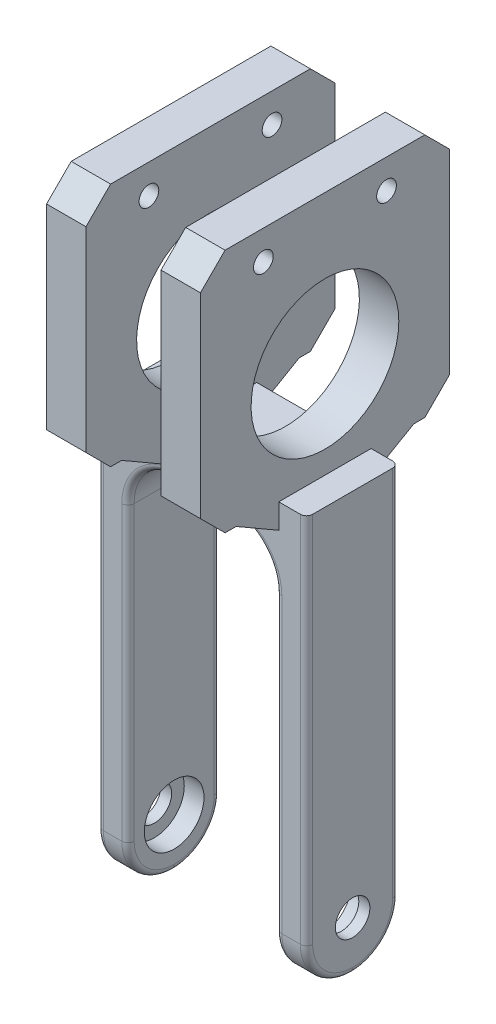
from build123d import *

# Parameters (mm, degrees)
SKETCH_1_W          = 34
SKETCH_1_H          = 15
EXTRUDE_1_DEPTH     = 68
SKETCH_3_W          = 24
SKETCH_3_H          = 63
CUT_EXTRUDE_1_DEPTH = 72.67984375
FILLET_1_R          = 8
FILLET_3_R          = 7.5
FILLET_2_R          = 1
SKETCH_4_R          = 2.8
CUT_EXTRUDE_2_DEPTH = 77.395353351
SKETCH_6_R          = 4.85
CUT_EXTRUDE_4_DEPTH = 3.2
SKETCH_7_W          = 40.44939287
SKETCH_7_H          = 39.770190269
SKETCH_7_R          = 12
SKETCH_7_R_2        = 1.6
EXTRUDE_2_DEPTH     = 12.5
SKETCH_8_W          = 12.191161996
SKETCH_8_H          = 39.770190269
CUT_EXTRUDE_5_DEPTH = 81.926839783
CHAMFER_1_SIZE      = 4
CHAMFER_1_SIZE_2    = 6.92820323
CHAMFER_2_SIZE      = 4


# Some blends are built 0.0001 mm under size
with BuildPart() as part:
    # 草图1 → 凸台-拉伸1 (new body)
    with BuildSketch(Plane(origin=(0, 0, 0), x_dir=(1, 0, 0), z_dir=(0, 1, 0))):
        Rectangle(SKETCH_1_W, SKETCH_1_H)
    extrude(amount=-EXTRUDE_1_DEPTH)

    # 草图3 → 切除-拉伸1 (cut, through all)
    with BuildSketch(Plane.XY.offset(7.5)):
        with Locations((0, -36.5)):
            Rectangle(SKETCH_3_W, SKETCH_3_H)
    extrude(amount=-CUT_EXTRUDE_1_DEPTH, mode=Mode.SUBTRACT)

    # 圆角1
    fillet_1_edges = [part.edges().sort_by_distance(p)[0] for p in [
        (-12, -5, 0),
        (12, -5, 0),
    ]]
    fillet(fillet_1_edges, radius=FILLET_1_R)

    # 圆角3
    fillet_3_edges = [part.edges().sort_by_distance(p)[0] for p in [
        (14.5, -68, -7.5),
        (14.5, -68, 7.5),
        (-14.5, -68, -7.5),
        (-14.5, -68, 7.5),
    ]]
    fillet(fillet_3_edges, radius=FILLET_3_R - 0.0001)  # a hair under: the kernel refuses the full size

    # 圆角2
    fillet_2_edges = [part.edges().sort_by_distance(p)[0] for p in [
        (0, -5, 7.5),
        (0, -5, -7.5),
        (-12, -36.75005, 7.5),
        (-12, -36.75005, -7.5),
        (9.656854249, -7.343145751, 7.5),
        (9.656854249, -7.343145751, -7.5),
        (-9.656854249, -7.343145751, 7.5),
        (-9.656854249, -7.343145751, -7.5),
        (-17, -30.25005, -7.5),
        (17, -30.25005, -7.5),
        (12, -36.75005, -7.5),
        (12, -36.75005, 7.5),
        (12, -65.803330148, 5.303330148),
        (12, -65.803330148, -5.303330148),
        (17, -30.25005, 7.5),
        (17, -65.803330148, 5.303330148),
        (17, -65.803330148, -5.303330148),
        (-17, -30.25005, 7.5),
        (-17, -65.803330148, 5.303330148),
        (-17, -65.803330148, -5.303330148),
        (-12, -65.803330148, 5.303330148),
        (-12, -65.803330148, -5.303330148),
    ]]
    fillet(fillet_2_edges, radius=FILLET_2_R)

    # 草图4 → 切除-拉伸2 (cut, through all)
    with BuildSketch(Plane(origin=(17, 0, 0), x_dir=(0, 0, -1), z_dir=(1, 0, 0))):
        with Locations((0, -60)):
            Circle(SKETCH_4_R)
    extrude(amount=-CUT_EXTRUDE_2_DEPTH, mode=Mode.SUBTRACT)

    # 草图6 → 切除-拉伸4 (cut)
    with BuildSketch(Plane(origin=(12, 0, 0), x_dir=(0, 0, -1), z_dir=(1, 0, 0))):
        with Locations((0, -60)):
            Circle(SKETCH_6_R)
    cut_extrude_4 = extrude(amount=CUT_EXTRUDE_4_DEPTH, mode=Mode.SUBTRACT)

    # 镜向1: 切除-拉伸4 across plane
    add(cut_extrude_4.mirror(Plane(origin=(0, 0, 0), x_dir=(0, 0, 1), z_dir=(1, 0, 0))), mode=Mode.SUBTRACT)

    # 草图7 → 凸台-拉伸2 (add, symmetric)
    with BuildSketch(Plane(origin=(0, 0, 0), x_dir=(0, 0, -1), z_dir=(1, 0, 0))):
        with Locations((0, 19.885095135)):
            Rectangle(SKETCH_7_W, SKETCH_7_H)
        with Locations((0, 15.650854712)):
            Circle(SKETCH_7_R, mode=Mode.SUBTRACT)
        with Locations((-10, 35)):
            Circle(SKETCH_7_R_2, mode=Mode.SUBTRACT)
        with Locations((10, 35)):
            Circle(SKETCH_7_R_2, mode=Mode.SUBTRACT)
    extrude(amount=EXTRUDE_2_DEPTH, both=True)

    # 草图8 → 切除-拉伸5 (cut, through all)
    with BuildSketch(Plane.XY.offset(20.224696435)):
        with Locations((0, 19.885095135)):
            Rectangle(SKETCH_8_W, SKETCH_8_H)
    extrude(amount=-CUT_EXTRUDE_5_DEPTH, mode=Mode.SUBTRACT)

    # 倒角1
    # the kernel refuses this chamfer: 6.92820323, 4 mm, written as the material it adds along each edge
    with BuildSketch(Plane(origin=(-12.5, 0, 7.5), x_dir=(0, -0.9983227437537926, -0.057893862402671484), z_dir=(1, 0, 0)), Plane(origin=(6.095580998, 0, 7.5), x_dir=(0, -0.9983227437537926, -0.057893862402671484), z_dir=(1, 0, 0)), Plane(origin=(12.5, 0, -7.5), x_dir=(0, -0.9983227437537926, 0.057893862402671484), z_dir=(-1, 0, 0)), Plane(origin=(-6.095580998, 0, -7.5), x_dir=(0, -0.9983227437537926, 0.057893862402671484), z_dir=(-1, 0, 0))) as chamfer_1_piece_1:
        Polygon((CHAMFER_1_SIZE * 0.998322743754, -CHAMFER_1_SIZE * 0.0578938624027), (-CHAMFER_1_SIZE_2 * 0.057893862405, -CHAMFER_1_SIZE_2 * 0.998322743793), (0, 0), align=None)
    extrude(amount=6.404419002)
    with BuildSketch(Plane(origin=(-30.423855882, 0, 7.5), x_dir=(0, -0.9983227437537926, -0.057893862402671484), z_dir=(1, 0, 0))) as chamfer_1_piece_2_section:
        Polygon((CHAMFER_1_SIZE * 0.998322743754, -CHAMFER_1_SIZE * 0.0578938624027), (-CHAMFER_1_SIZE_2 * 0.057893862405, -CHAMFER_1_SIZE_2 * 0.998322743793), (0, 0), align=None)
    chamfer_1_piece_2 = extrude(amount=42.252130767, mode=Mode.PRIVATE)
    chamfer_1_piece_2 = split(chamfer_1_piece_2, bisect_by=Plane(origin=(6.095580998, -1.333333333, 9.809401077), z_dir=(1, 0, 0)), keep=Keep.TOP, mode=Mode.PRIVATE)
    add(chamfer_1_piece_2)
    with BuildSketch(Plane(origin=(-11.828274885, 0, 7.5), x_dir=(0, -0.9983227437537926, -0.057893862402671484), z_dir=(1, 0, 0))) as chamfer_1_piece_3_section:
        Polygon((CHAMFER_1_SIZE * 0.998322743754, -CHAMFER_1_SIZE * 0.0578938624027), (-CHAMFER_1_SIZE_2 * 0.057893862405, -CHAMFER_1_SIZE_2 * 0.998322743793), (0, 0), align=None)
    chamfer_1_piece_3 = extrude(amount=42.252130767, mode=Mode.PRIVATE)
    chamfer_1_piece_3 = split(chamfer_1_piece_3, bisect_by=Plane(origin=(-6.095580998, -1.333333333, 9.809401077), z_dir=(-1, 0, 0)), keep=Keep.TOP, mode=Mode.PRIVATE)
    add(chamfer_1_piece_3)
    with BuildSketch(Plane(origin=(30.423855882, 0, -7.5), x_dir=(0, -0.9983227437537926, 0.057893862402671484), z_dir=(-1, 0, 0))) as chamfer_1_piece_4_section:
        Polygon((CHAMFER_1_SIZE * 0.998322743754, -CHAMFER_1_SIZE * 0.0578938624027), (-CHAMFER_1_SIZE_2 * 0.057893862405, -CHAMFER_1_SIZE_2 * 0.998322743793), (0, 0), align=None)
    chamfer_1_piece_4 = extrude(amount=42.252130767, mode=Mode.PRIVATE)
    chamfer_1_piece_4 = split(chamfer_1_piece_4, bisect_by=Plane(origin=(-6.095580998, -1.333333333, -9.809401077), z_dir=(-1, 0, 0)), keep=Keep.TOP, mode=Mode.PRIVATE)
    add(chamfer_1_piece_4)
    with BuildSketch(Plane(origin=(11.828274885, 0, -7.5), x_dir=(0, -0.9983227437537926, 0.057893862402671484), z_dir=(-1, 0, 0))) as chamfer_1_piece_5_section:
        Polygon((CHAMFER_1_SIZE * 0.998322743754, -CHAMFER_1_SIZE * 0.0578938624027), (-CHAMFER_1_SIZE_2 * 0.057893862405, -CHAMFER_1_SIZE_2 * 0.998322743793), (0, 0), align=None)
    chamfer_1_piece_5 = extrude(amount=42.252130767, mode=Mode.PRIVATE)
    chamfer_1_piece_5 = split(chamfer_1_piece_5, bisect_by=Plane(origin=(6.095580998, -1.333333333, -9.809401077), z_dir=(1, 0, 0)), keep=Keep.TOP, mode=Mode.PRIVATE)
    add(chamfer_1_piece_5)

    # 倒角2
    chamfer_2_edges = [part.edges().sort_by_distance(p)[0] for p in [
        (9.297790499, 0, 20.224696435),
        (9.297790499, 39.770190269, 20.224696435),
        (9.297790499, 0, -20.224696435),
        (9.297790499, 39.770190269, -20.224696435),
        (-9.297790499, 39.770190269, 20.224696435),
        (-9.297790499, 39.770190269, -20.224696435),
        (-9.297790499, 0, -20.224696435),
        (-9.297790499, 0, 20.224696435),
    ]]
    chamfer(chamfer_2_edges, length=CHAMFER_2_SIZE)


solid = part.part
